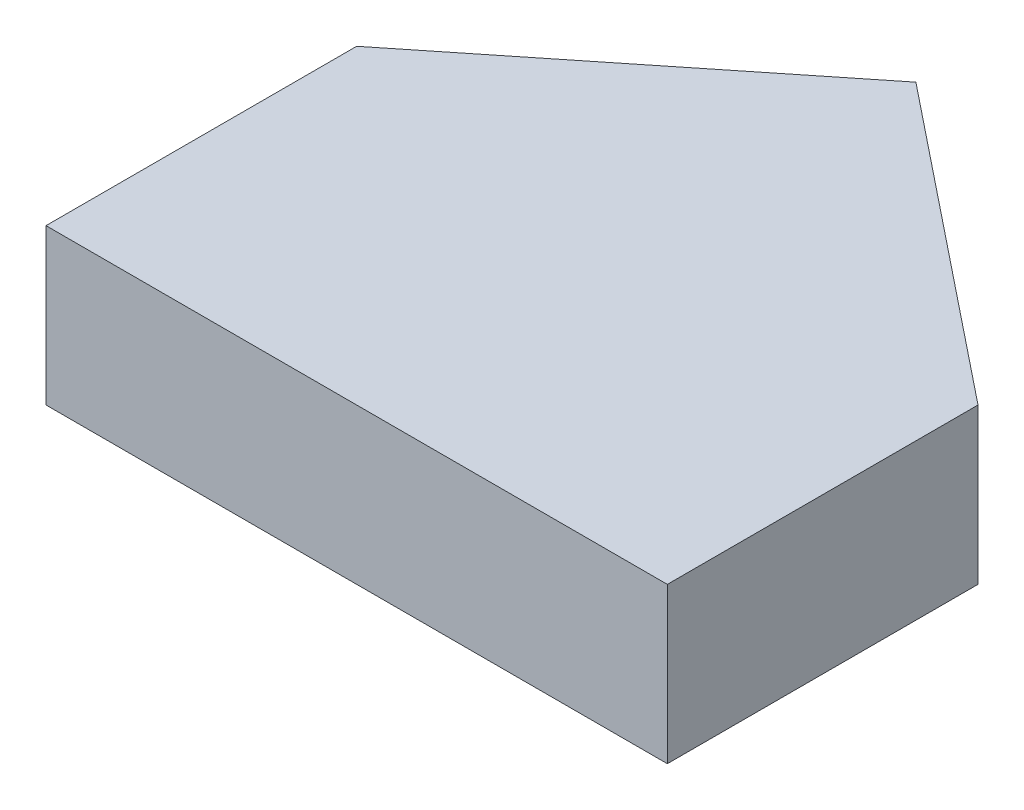
from build123d import *

# Parameters (mm, degrees)
BOSS_EXTRUDE1_DEPTH = 5


with BuildPart() as part:
    # Sketch1 → Boss-Extrude1 (new body)
    with BuildSketch(Plane(origin=(0, 0, 0), x_dir=(1, 0, 0), z_dir=(0, 1, 0))):
        Polygon((-10, 0), (0, 8), (10, 0), (10, -10), (-10, -10), align=None)
    extrude(amount=BOSS_EXTRUDE1_DEPTH)


solid = part.part
